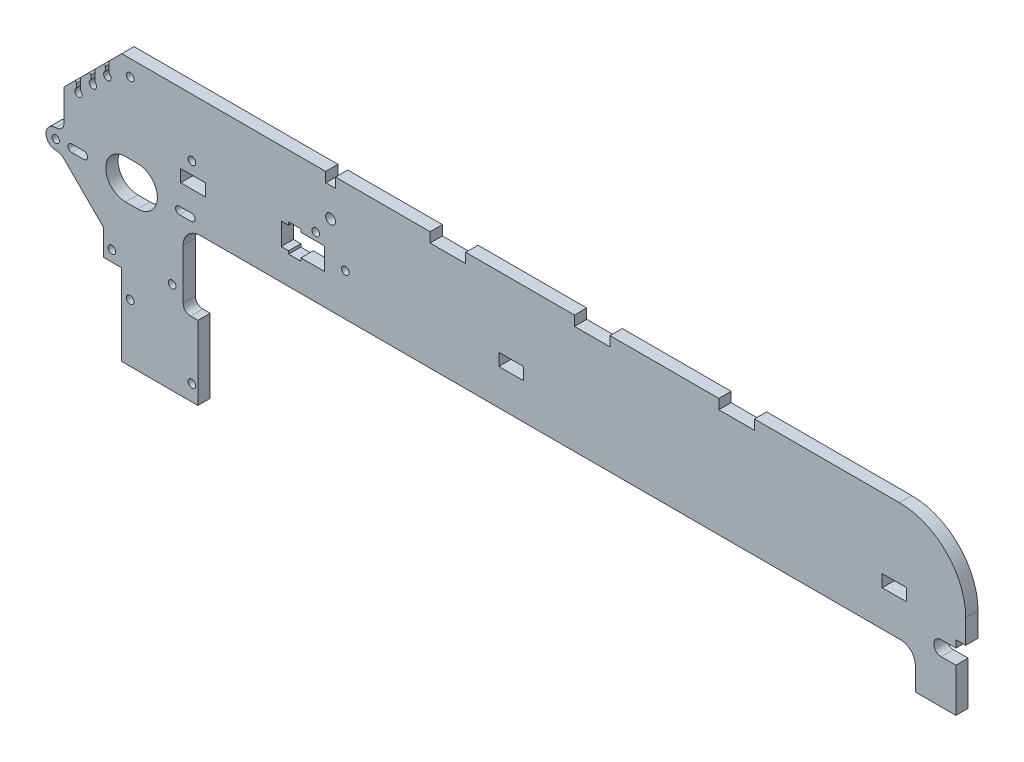
from build123d import *

# Parameters (mm, degrees)
SKETCH1_R           = 1.5
SKETCH1_R_2         = 8
SKETCH1_R_3         = 1.55
SKETCH1_R_4         = 2
SKETCH1_W           = 10
SKETCH1_H           = 5
BOSS_EXTRUDE1_DEPTH = 5
FILLET2_R           = 7
FILLET3_R           = 3
CUT_EXTRUDE1_DEPTH  = 344.247723955
FILLET4_R           = 6
CUT_EXTRUDE2_DEPTH  = 344.247723955
FILLET5_R           = 0.5


with BuildPart() as part:
    # Sketch1 → Boss-Extrude1 (new body)
    with BuildSketch(Plane.XY):
        with BuildLine():
            Line((310, 43.5), (251, 43.5))
            Line((251, 43.5), (251, 39.5))
            Line((251, 39.5), (236.5, 39.5))
            Line((236.5, 39.5), (236.5, 43.5))
            Line((236.5, 43.5), (192.25, 43.5))
            Line((192.25, 43.5), (192.25, 39.5))
            Line((192.25, 39.5), (177.75, 39.5))
            Line((177.75, 39.5), (177.75, 43.5))
            Line((177.75, 43.5), (133.5, 43.5))
            Line((133.5, 43.5), (133.5, 39.5))
            Line((133.5, 39.5), (119, 39.5))
            Line((119, 39.5), (119, 43.5))
            Line((119, 43.5), (80.5, 43.5))
            Line((80.5, 43.5), (80.5, 39.5))
            Line((80.5, 39.5), (76.5, 39.5))
            Line((76.5, 39.5), (76.5, 43.5))
            Line((76.5, 43.5), (-6.5, 43.5))
            Line((-6.5, 43.5), (-30, 20))
            Line((-30, 20), (-30, 7.325414703))
            ThreePointArc((-30, 7.325414703), (-30.985037822, 4.947323034), (-33.36312949, 3.962285212))
            ThreePointArc((-33.36312949, 3.962285212), (-37.325414703, 0), (-33.36312949, -3.962285212))
            ThreePointArc((-33.36312949, -3.962285212), (-31.543016926, -4.324328111), (-30, -5.355339059))
            Line((-30, -5.355339059), (-14, -21.355339059))
            Line((-14, -21.355339059), (-14, -32))
            Line((-14, -32), (-6.5, -32))
            Line((-6.5, -32), (-6.5, -65))
            Line((-6.5, -65), (24.5, -65))
            Line((24.5, -65), (24.5, -35))
            Line((24.5, -35), (18.5, -35))
            Line((18.5, -35), (18.5, -4.6))
            Line((18.5, -4.6), (316.5, -4.6))
            Line((316.5, -4.6), (316.5, -20))
            Line((316.5, -20), (333, -20))
            Line((333, -20), (333, -2.3))
            Line((333, -2.3), (327, -2.3))
            ThreePointArc((327, -2.3), (324, 0.7), (327, 3.7))
            Line((327, 3.7), (333, 3.7))
            Line((333, 3.7), (333, 6.7))
            Line((333, 6.7), (337, 6.7))
            Line((337, 6.7), (337, 16.5))
            ThreePointArc((337, 16.5), (329.091883092, 35.591883092), (310, 43.5))
        make_face()
        with Locations((21.920310217, 0)):
            Circle(SKETCH1_R, mode=Mode.SUBTRACT)
        with Locations((-21.920310217, 0)):
            Circle(SKETCH1_R, mode=Mode.SUBTRACT)
        Circle(SKETCH1_R_2, mode=Mode.SUBTRACT)
        with Locations((-3.05, 37)):
            Circle(SKETCH1_R_3, mode=Mode.SUBTRACT)
        with Locations((22.05, 20)):
            Circle(SKETCH1_R_3, mode=Mode.SUBTRACT)
        with Locations((-3.05, -41.5)):
            Circle(SKETCH1_R_3, mode=Mode.SUBTRACT)
        with Locations((22.05, -58.5)):
            Circle(SKETCH1_R_3, mode=Mode.SUBTRACT)
        with Locations((72.5, 20.1)):
            Circle(SKETCH1_R_3, mode=Mode.SUBTRACT)
        with Locations((84.5, 12.5)):
            Circle(SKETCH1_R_3, mode=Mode.SUBTRACT)
        with Locations((-10.5, -27.55)):
            Circle(SKETCH1_R_3, mode=Mode.SUBTRACT)
        with Locations((14, -27.55)):
            Circle(SKETCH1_R_3, mode=Mode.SUBTRACT)
        with Locations((-33.36312949, 0)):
            Circle(SKETCH1_R, mode=Mode.SUBTRACT)
        with Locations((78.5, 27.751425951)):
            Circle(SKETCH1_R_4, mode=Mode.SUBTRACT)
        with Locations((22.5, 12.5)):
            Rectangle(SKETCH1_W, SKETCH1_H, mode=Mode.SUBTRACT)
        with Locations((152, 12.5)):
            Rectangle(SKETCH1_W, SKETCH1_H, mode=Mode.SUBTRACT)
        with Locations((308, 12.5)):
            Rectangle(SKETCH1_W, SKETCH1_H, mode=Mode.SUBTRACT)
        Polygon((58.427680349, 8), (61.427680349, 8), (61.427680349, 6.806102344), (66.427680349, 6.806102344), (66.427680349, 8), (76, 8), (76, 17), (66.427680349, 17), (66.427680349, 18.193897656), (61.427680349, 18.193897656), (61.427680349, 17), (58.427680349, 17), align=None, mode=Mode.SUBTRACT)
    extrude(amount=BOSS_EXTRUDE1_DEPTH)

    # Fillet2
    fillet2_edges = [part.edges().sort_by_distance(p)[0] for p in [
        (18.5, -4.6, 2.5),
    ]]
    fillet(fillet2_edges, radius=FILLET2_R)

    # Fillet3
    fillet3_edges = [part.edges().sort_by_distance(p)[0] for p in [
        (18.5, -35, 2.5),
    ]]
    fillet(fillet3_edges, radius=FILLET3_R)

    # Sketch2 → Cut-Extrude1 (cut, through all)
    with BuildSketch(Plane.XY.offset(5)):
        with BuildLine():
            Line((21.920310217, -1.5), (16.920310217, -1.5))
            ThreePointArc((16.920310217, -1.5), (15.420310217, 0), (16.920310217, 1.5))
            Line((16.920310217, 1.5), (21.920310217, 1.5))
            ThreePointArc((21.920310217, 1.5), (23.420310217, 0), (21.920310217, -1.5))
        make_face()
        with BuildLine():
            Line((0, -8), (-5, -8))
            ThreePointArc((-5, -8), (-13, 0), (-5, 8))
            Line((-5, 8), (0, 8))
            ThreePointArc((0, 8), (8, 0), (0, -8))
        make_face()
        with BuildLine():
            Line((-21.920310217, -1.5), (-26.920310217, -1.5))
            ThreePointArc((-26.920310217, -1.5), (-28.420310217, 0), (-26.920310217, 1.5))
            Line((-26.920310217, 1.5), (-21.920310217, 1.5))
            ThreePointArc((-21.920310217, 1.5), (-20.420310217, 0), (-21.920310217, -1.5))
        make_face()
    extrude(amount=-CUT_EXTRUDE1_DEPTH, mode=Mode.SUBTRACT)

    # Fillet4
    fillet4_edges = [part.edges().sort_by_distance(p)[0] for p in [
        (316.5, -4.6, 2.5),
    ]]
    fillet(fillet4_edges, radius=FILLET4_R)

    # Sketch3 → Cut-Extrude2 (cut, through all)
    with BuildSketch(Plane.XY.offset(5)):
        with BuildLine():
            Line((-13.125, 42.835857073), (-11.625, 42.835857073))
            Line((-11.625, 42.835857073), (-11.625, 33.924038106))
            ThreePointArc((-11.625, 33.924038106), (-12.375, 31.125), (-13.125, 33.924038106))
            Line((-13.125, 33.924038106), (-13.125, 42.835857073))
        make_face()
        with BuildLine():
            Line((-17.4, 36.92183731), (-17.4, 27.985920709))
            ThreePointArc((-17.4, 27.985920709), (-18.25, 25.25), (-19.1, 27.985920709))
            Line((-19.1, 27.985920709), (-19.1, 36.92183731))
            Line((-19.1, 36.92183731), (-17.4, 36.92183731))
        make_face()
        with BuildLine():
            Line((-23.275, 31.04683731), (-23.275, 22.110920709))
            ThreePointArc((-23.275, 22.110920709), (-24.125, 19.375), (-24.975, 22.110920709))
            Line((-24.975, 22.110920709), (-24.975, 31.04683731))
            Line((-24.975, 31.04683731), (-23.275, 31.04683731))
        make_face()
    extrude(amount=-CUT_EXTRUDE2_DEPTH, mode=Mode.SUBTRACT)

    # Fillet5
    fillet5_edges = [part.edges().sort_by_distance(p)[0] for p in [
        (-24.975, 25.025, 2.5),
        (-19.1, 30.9, 2.5),
        (-13.125, 36.875, 2.5),
    ]]
    fillet(fillet5_edges, radius=FILLET5_R)


solid = part.part
